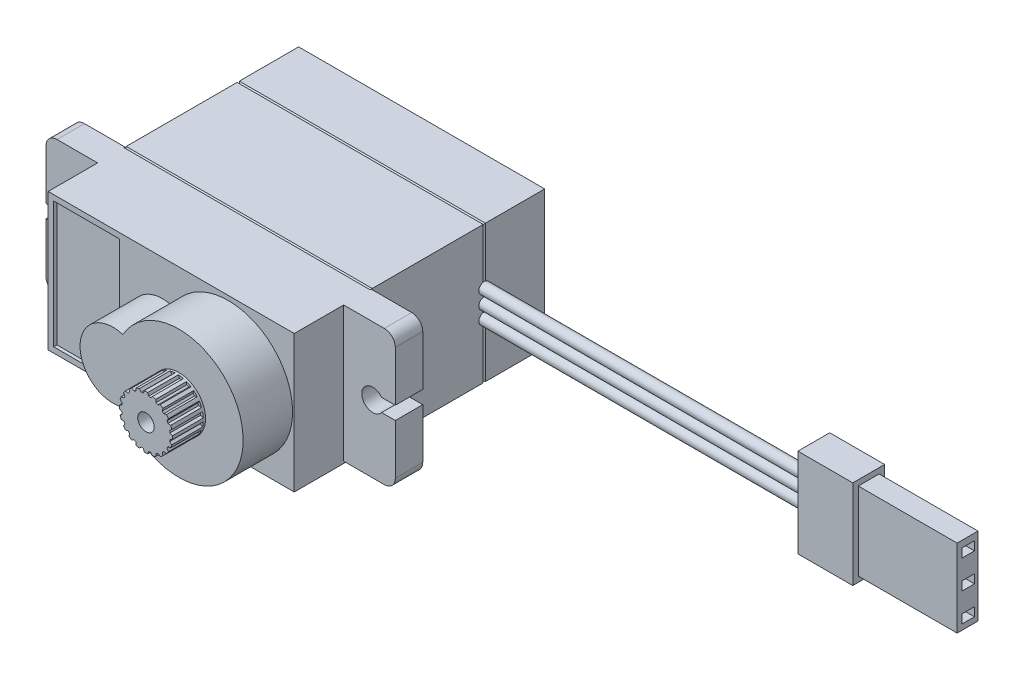
from build123d import *

# Parameters (mm, degrees)
SKETCH_1_W          = 22.4
SKETCH_1_H          = 12.5
EXTRUDE_1_DEPTH     = 5.5
CHAMFER_1_SIZE      = 0.1
SKETCH_2_W          = 22.4
SKETCH_2_H          = 12.5
EXTRUDE_2_DEPTH     = 10.3
CHAMFER_2_SIZE      = 0.1
CHAMFER_3_SIZE      = 0.1
SKETCH_3_W          = 22.4
SKETCH_3_H          = 12.5
EXTRUDE_3_DEPTH     = 7
CHAMFER_4_SIZE      = 0.1
EXTRUDE_4_DEPTH     = 2.5
EXTRUDE_5_DEPTH     = 4.5
SKETCH_6_R          = 2.425
EXTRUDE_6_DEPTH     = 3
SKETCH_7_R          = 0.75
CUT_EXTRUDE_1_DEPTH = 6
CUT_EXTRUDE_START   = -2.8
CUT_EXTRUDE_2_DEPTH = 2.8
SKETCH_9_R          = 0.5
EXTRUDE_7_DEPTH     = 30
SKETCH_10_W         = 2.9
SKETCH_10_H         = 8.1
EXTRUDE_8_DEPTH     = 5
SKETCH_11_W         = 1.9
SKETCH_11_H         = 7.1
SKETCH_11_W_2       = 1.155481654
SKETCH_11_H_2       = 0.8
EXTRUDE_9_DEPTH     = 9
FILLET_2_R          = 1
SKETCH_12_W         = 6
SKETCH_12_H         = 11.5
CUT_EXTRUDE_3_DEPTH = 0.3
SKETCH_13_R         = 1
EXTRUDE_10_DEPTH    = 0.1


with BuildPart() as part:
    # 草图1 → 凸台-拉伸1 (new body)
    with BuildSketch(Plane.XY):
        Rectangle(SKETCH_1_W, SKETCH_1_H)
    extrude(amount=EXTRUDE_1_DEPTH)

    # 倒角1
    chamfer_1_edges = [part.edges().sort_by_distance(p)[0] for p in [
        (11.2, 0, 5.5),
        (0, 6.25, 5.5),
        (-11.2, 0, 5.5),
        (0, -6.25, 5.5),
    ]]
    chamfer(chamfer_1_edges, length=CHAMFER_1_SIZE)

    # 草图2 → 凸台-拉伸2 (add)
    with BuildSketch(Plane.XY.offset(5.5)):
        Rectangle(SKETCH_2_W, SKETCH_2_H)
    extrude(amount=EXTRUDE_2_DEPTH)

    # 倒角2
    chamfer_2_edges = [part.edges().sort_by_distance(p)[0] for p in [
        (0, 6.25, 5.5),
        (-11.2, 0, 5.5),
        (0, -6.25, 5.5),
        (11.2, 0, 5.5),
    ]]
    chamfer(chamfer_2_edges, length=CHAMFER_2_SIZE - 0.0001)  # a hair under: the kernel refuses the full size

    # 倒角3
    chamfer_3_edges = [part.edges().sort_by_distance(p)[0] for p in [
        (0, 6.25, 15.8),
        (-11.2, 0, 15.8),
        (0, -6.25, 15.8),
        (11.2, 0, 15.8),
    ]]
    chamfer(chamfer_3_edges, length=CHAMFER_3_SIZE)

    # 草图3 → 凸台-拉伸3 (add)
    with BuildSketch(Plane.XY.offset(15.8)):
        Rectangle(SKETCH_3_W, SKETCH_3_H)
    extrude(amount=EXTRUDE_3_DEPTH)

    # 倒角4
    chamfer_4_edges = [part.edges().sort_by_distance(p)[0] for p in [
        (0, 6.25, 15.8),
        (-11.2, 0, 15.8),
        (0, -6.25, 15.8),
        (11.2, 0, 15.8),
    ]]
    chamfer(chamfer_4_edges, length=CHAMFER_4_SIZE - 0.0001)  # a hair under: the kernel refuses the full size

    # 草图4 → 凸台-拉伸4 (add)
    with BuildSketch(Plane.XY.offset(15.8)):
        with BuildLine():
            Line((-15.9, -0.508346778), (-15.9, -6.066693556))
            Line((-15.9, -6.066693556), (-11.2, -6.066693556))
            Line((-11.2, -6.066693556), (-11.2, 6.25))
            Line((-11.2, 6.25), (-15.9, 6.25))
            Line((-15.9, 6.25), (-15.9, 0.691653222))
            Line((-15.9, 0.691653222), (-14.65, 0.691653222))
            ThreePointArc((-14.65, 0.691653222), (-12.85, 0.091653222), (-14.65, -0.508346778))
            Line((-14.65, -0.508346778), (-15.9, -0.508346778))
        make_face()
        with BuildLine():
            Line((11.2, -6.066693556), (15.9, -6.066693556))
            Line((15.9, -6.066693556), (15.9, -0.508346778))
            Line((15.9, -0.508346778), (14.65, -0.508346778))
            ThreePointArc((14.65, -0.508346778), (12.85, 0.091653222), (14.65, 0.691653222))
            Line((14.65, 0.691653222), (15.9, 0.691653222))
            Line((15.9, 0.691653222), (15.9, 6.25))
            Line((15.9, 6.25), (11.2, 6.25))
            Line((11.2, 6.25), (11.2, -6.066693556))
        make_face()
    extrude(amount=EXTRUDE_4_DEPTH)

    # 草图5 → 凸台-拉伸5 (add)
    with BuildSketch(Plane.XY.offset(22.8)):
        with BuildLine():
            ThreePointArc((0.098125, -2.86240659), (11.05, 0), (0.098125, 2.86240659))
            ThreePointArc((0.098125, 2.86240659), (-3.8, 0), (0.098125, -2.86240659))
        make_face()
    extrude(amount=EXTRUDE_5_DEPTH)

    # 草图6 → 凸台-拉伸6 (add)
    with BuildSketch(Plane.XY.offset(27.3)):
        with Locations((5.2, 0)):
            Circle(SKETCH_6_R)
    extrude(amount=EXTRUDE_6_DEPTH)

    # 草图7 → 切除-拉伸1 (cut)
    with BuildSketch(Plane.XY.offset(30.3)):
        with Locations((5.2, 0)):
            Circle(SKETCH_7_R)
    extrude(amount=-CUT_EXTRUDE_1_DEPTH, mode=Mode.SUBTRACT)

    # 草图8 → 切除-拉伸2 (cut)
    with BuildSketch(Plane.XY.offset(30.3).offset(CUT_EXTRUDE_START)):
        with BuildLine():
            Line((4.95, 2.185749299), (5.05, 2.420356379))
            ThreePointArc((5.05, 2.420356379), (4.820646422, 2.395144226), (4.594727224, 2.348248255))
            Line((4.594727224, 2.348248255), (4.76233045, 2.156025363))
            ThreePointArc((4.76233045, 2.156025363), (4.855844177, 2.172914349), (4.95, 2.185749299))
        make_face()
        with BuildLine():
            Line((5.45, 2.185749299), (5.35, 2.420356379))
            ThreePointArc((5.35, 2.420356379), (5.579353578, 2.395144226), (5.805272776, 2.348248255))
            Line((5.805272776, 2.348248255), (5.63766955, 2.156025363))
            ThreePointArc((5.63766955, 2.156025363), (5.544155823, 2.172914349), (5.45, 2.185749299))
        make_face()
        with BuildLine():
            Line((6.113197808, 2.001516866), (6.090589731, 2.255543157))
            ThreePointArc((6.090589731, 2.255543157), (6.300926962, 2.160690821), (6.501297236, 2.046277231))
            Line((6.501297236, 2.046277231), (6.282496955, 1.915254642))
            ThreePointArc((6.282496955, 1.915254642), (6.198779099, 1.960214353), (6.113197808, 2.001516866))
        make_face()
        with BuildLine():
            Line((6.687005452, 1.621362016), (6.744002334, 1.869941655))
            ThreePointArc((6.744002334, 1.869941655), (6.914733944, 1.714733944), (7.069941655, 1.544002334))
            Line((7.069941655, 1.544002334), (6.821362016, 1.487005452))
            ThreePointArc((6.821362016, 1.487005452), (6.755634919, 1.555634919), (6.687005452, 1.621362016))
        make_face()
        with BuildLine():
            Line((7.115254642, 1.082496955), (7.246277231, 1.301297236))
            ThreePointArc((7.246277231, 1.301297236), (7.360690821, 1.100926962), (7.455543157, 0.890589731))
            Line((7.455543157, 0.890589731), (7.201516866, 0.913197808))
            ThreePointArc((7.201516866, 0.913197808), (7.160214353, 0.998779099), (7.115254642, 1.082496955))
        make_face()
        with BuildLine():
            Line((7.356025363, 0.43766955), (7.548248255, 0.605272776))
            ThreePointArc((7.548248255, 0.605272776), (7.595144226, 0.379353578), (7.620356379, 0.15))
            Line((7.620356379, 0.15), (7.385749299, 0.25))
            ThreePointArc((7.385749299, 0.25), (7.372914349, 0.344155823), (7.356025363, 0.43766955))
        make_face()
        with BuildLine():
            Line((7.385749299, -0.25), (7.620356379, -0.15))
            ThreePointArc((7.620356379, -0.15), (7.595144226, -0.379353578), (7.548248255, -0.605272776))
            Line((7.548248255, -0.605272776), (7.356025363, -0.43766955))
            ThreePointArc((7.356025363, -0.43766955), (7.372914349, -0.344155823), (7.385749299, -0.25))
        make_face()
        with BuildLine():
            Line((7.201516866, -0.913197808), (7.455543157, -0.890589731))
            ThreePointArc((7.455543157, -0.890589731), (7.360690821, -1.100926962), (7.246277231, -1.301297236))
            Line((7.246277231, -1.301297236), (7.115254642, -1.082496955))
            ThreePointArc((7.115254642, -1.082496955), (7.160214353, -0.998779099), (7.201516866, -0.913197808))
        make_face()
        with BuildLine():
            Line((6.821362016, -1.487005452), (7.069941655, -1.544002334))
            ThreePointArc((7.069941655, -1.544002334), (6.914733944, -1.714733944), (6.744002334, -1.869941655))
            Line((6.744002334, -1.869941655), (6.687005452, -1.621362016))
            ThreePointArc((6.687005452, -1.621362016), (6.755634919, -1.555634919), (6.821362016, -1.487005452))
        make_face()
        with BuildLine():
            Line((6.282496955, -1.915254642), (6.501297236, -2.046277231))
            ThreePointArc((6.501297236, -2.046277231), (6.300926962, -2.160690821), (6.090589731, -2.255543157))
            Line((6.090589731, -2.255543157), (6.113197808, -2.001516866))
            ThreePointArc((6.113197808, -2.001516866), (6.198779099, -1.960214353), (6.282496955, -1.915254642))
        make_face()
        with BuildLine():
            Line((5.63766955, -2.156025363), (5.805272776, -2.348248255))
            ThreePointArc((5.805272776, -2.348248255), (5.579353578, -2.395144226), (5.35, -2.420356379))
            Line((5.35, -2.420356379), (5.45, -2.185749299))
            ThreePointArc((5.45, -2.185749299), (5.544155823, -2.172914349), (5.63766955, -2.156025363))
        make_face()
        with BuildLine():
            Line((4.95, -2.185749299), (5.05, -2.420356379))
            ThreePointArc((5.05, -2.420356379), (4.820646422, -2.395144226), (4.594727224, -2.348248255))
            Line((4.594727224, -2.348248255), (4.76233045, -2.156025363))
            ThreePointArc((4.76233045, -2.156025363), (4.855844177, -2.172914349), (4.95, -2.185749299))
        make_face()
        with BuildLine():
            Line((4.286802192, -2.001516866), (4.309410269, -2.255543157))
            ThreePointArc((4.309410269, -2.255543157), (4.099073038, -2.160690821), (3.898702764, -2.046277231))
            Line((3.898702764, -2.046277231), (4.117503045, -1.915254642))
            ThreePointArc((4.117503045, -1.915254642), (4.201220901, -1.960214353), (4.286802192, -2.001516866))
        make_face()
        with BuildLine():
            Line((3.712994548, -1.621362016), (3.655997666, -1.869941655))
            ThreePointArc((3.655997666, -1.869941655), (3.485266056, -1.714733944), (3.330058345, -1.544002334))
            Line((3.330058345, -1.544002334), (3.578637984, -1.487005452))
            ThreePointArc((3.578637984, -1.487005452), (3.644365081, -1.555634919), (3.712994548, -1.621362016))
        make_face()
        with BuildLine():
            Line((3.284745358, -1.082496955), (3.153722769, -1.301297236))
            ThreePointArc((3.153722769, -1.301297236), (3.039309179, -1.100926962), (2.944456843, -0.890589731))
            Line((2.944456843, -0.890589731), (3.198483134, -0.913197808))
            ThreePointArc((3.198483134, -0.913197808), (3.239785647, -0.998779099), (3.284745358, -1.082496955))
        make_face()
        with BuildLine():
            Line((3.043974637, -0.43766955), (2.851751745, -0.605272776))
            ThreePointArc((2.851751745, -0.605272776), (2.804855774, -0.379353578), (2.779643621, -0.15))
            Line((2.779643621, -0.15), (3.014250701, -0.25))
            ThreePointArc((3.014250701, -0.25), (3.027085651, -0.344155823), (3.043974637, -0.43766955))
        make_face()
        with BuildLine():
            Line((3.014250701, 0.25), (2.779643621, 0.15))
            ThreePointArc((2.779643621, 0.15), (2.804855774, 0.379353578), (2.851751745, 0.605272776))
            Line((2.851751745, 0.605272776), (3.043974637, 0.43766955))
            ThreePointArc((3.043974637, 0.43766955), (3.027085651, 0.344155823), (3.014250701, 0.25))
        make_face()
        with BuildLine():
            Line((3.198483134, 0.913197808), (2.944456843, 0.890589731))
            ThreePointArc((2.944456843, 0.890589731), (3.039309179, 1.100926962), (3.153722769, 1.301297236))
            Line((3.153722769, 1.301297236), (3.284745358, 1.082496955))
            ThreePointArc((3.284745358, 1.082496955), (3.239785647, 0.998779099), (3.198483134, 0.913197808))
        make_face()
        with BuildLine():
            Line((3.578637984, 1.487005452), (3.330058345, 1.544002334))
            ThreePointArc((3.330058345, 1.544002334), (3.485266056, 1.714733944), (3.655997666, 1.869941655))
            Line((3.655997666, 1.869941655), (3.712994548, 1.621362016))
            ThreePointArc((3.712994548, 1.621362016), (3.644365081, 1.555634919), (3.578637984, 1.487005452))
        make_face()
        with BuildLine():
            Line((4.117503045, 1.915254642), (3.898702764, 2.046277231))
            ThreePointArc((3.898702764, 2.046277231), (4.099073038, 2.160690821), (4.309410269, 2.255543157))
            Line((4.309410269, 2.255543157), (4.286802192, 2.001516866))
            ThreePointArc((4.286802192, 2.001516866), (4.201220901, 1.960214353), (4.117503045, 1.915254642))
        make_face()
    extrude(amount=CUT_EXTRUDE_2_DEPTH, mode=Mode.SUBTRACT)

    # 草图9 → 凸台-拉伸7 (add)
    with BuildSketch(Plane(origin=(11.2, 0, 0), x_dir=(0, 0, -1), z_dir=(1, 0, 0))):
        with Locations(Location((-5.5, 0, 0), (0, 0, 101.536959033))):
            Circle(SKETCH_9_R)
        with Locations(Location((-5.5, 1.2, 0), (0, 0, 258.463040967))):
            Circle(SKETCH_9_R)
        with Locations(Location((-5.5, -1.2, 0), (0, 0, 101.536959033))):
            Circle(SKETCH_9_R)
    extrude(amount=EXTRUDE_7_DEPTH)

    # 草图10 → 凸台-拉伸8 (add)
    with BuildSketch(Plane(origin=(41.2, 0, 0), x_dir=(0, 0, -1), z_dir=(1, 0, 0))):
        with Locations((-5.5, 0)):
            Rectangle(SKETCH_10_W, SKETCH_10_H)
    extrude(amount=EXTRUDE_8_DEPTH)

    # 草图11 → 凸台-拉伸9 (add)
    with BuildSketch(Plane(origin=(46.2, 0, 0), x_dir=(0, 0, -1), z_dir=(1, 0, 0))):
        with Locations((-5.5, 0)):
            Rectangle(SKETCH_11_W, SKETCH_11_H)
        with Locations((-5.451131572, 2.55)):
            Rectangle(SKETCH_11_W_2, SKETCH_11_H_2, mode=Mode.SUBTRACT)
        with Locations((-5.451131572, -0.05)):
            Rectangle(SKETCH_11_W_2, SKETCH_11_H_2, mode=Mode.SUBTRACT)
        with Locations((-5.451131572, -2.65)):
            Rectangle(SKETCH_11_W_2, SKETCH_11_H_2, mode=Mode.SUBTRACT)
    extrude(amount=EXTRUDE_9_DEPTH)

    # 圆角2
    fillet_2_edges = [part.edges().sort_by_distance(p)[0] for p in [
        (15.9, -6.066693556, 17.05),
        (15.9, 6.25, 17.05),
        (-15.9, 6.25, 17.05),
        (-15.9, -6.066693556, 17.05),
    ]]
    fillet(fillet_2_edges, radius=FILLET_2_R)

    # 草图12 → 切除-拉伸3 (cut)
    with BuildSketch(Plane.XY.offset(22.8)):
        with Locations((-7.7, 0)):
            Rectangle(SKETCH_12_W, SKETCH_12_H)
    extrude(amount=-CUT_EXTRUDE_3_DEPTH, mode=Mode.SUBTRACT)

    # 草图13 → 凸台-拉伸10 (add)
    # profile 1 of 4: a face of its own
    with BuildSketch(Plane(origin=(0, 0, 0), x_dir=(-1, 0, 0), z_dir=(0, 0, -1))):
        with Locations(Location((-10, 5, 0), (0, 0, 180))):
            Circle(SKETCH_13_R)
        with BuildLine():
            Line((-10.15, 5.785811682), (-10.15, 5.15))
            Line((-10.15, 5.15), (-10.785811682, 5.15))
            ThreePointArc((-10.785811682, 5.15), (-10.8, 5), (-10.785811682, 4.85))
            Line((-10.785811682, 4.85), (-10.15, 4.85))
            Line((-10.15, 4.85), (-10.15, 4.214188318))
            ThreePointArc((-10.15, 4.214188318), (-10, 4.2), (-9.85, 4.214188318))
            Line((-9.85, 4.214188318), (-9.85, 4.85))
            Line((-9.85, 4.85), (-9.214188318, 4.85))
            ThreePointArc((-9.214188318, 4.85), (-9.2, 5), (-9.214188318, 5.15))
            Line((-9.214188318, 5.15), (-9.85, 5.15))
            Line((-9.85, 5.15), (-9.85, 5.785811682))
            ThreePointArc((-9.85, 5.785811682), (-10, 5.8), (-10.15, 5.785811682))
        make_face(mode=Mode.SUBTRACT)
    # profile 2 of 4: a face of its own
    with BuildSketch(Plane(origin=(0, 0, 0), x_dir=(-1, 0, 0), z_dir=(0, 0, -1))):
        with Locations(Location((-10, -5, 0), (0, 0, 180))):
            Circle(SKETCH_13_R)
        with BuildLine():
            Line((-9.85, -5.15), (-9.214188318, -5.15))
            ThreePointArc((-9.214188318, -5.15), (-9.2, -5), (-9.214188318, -4.85))
            Line((-9.214188318, -4.85), (-9.85, -4.85))
            Line((-9.85, -4.85), (-9.85, -4.214188318))
            ThreePointArc((-9.85, -4.214188318), (-10, -4.2), (-10.15, -4.214188318))
            Line((-10.15, -4.214188318), (-10.15, -4.85))
            Line((-10.15, -4.85), (-10.785811682, -4.85))
            ThreePointArc((-10.785811682, -4.85), (-10.8, -5), (-10.785811682, -5.15))
            Line((-10.785811682, -5.15), (-10.15, -5.15))
            Line((-10.15, -5.15), (-10.15, -5.785811682))
            ThreePointArc((-10.15, -5.785811682), (-10, -5.8), (-9.85, -5.785811682))
            Line((-9.85, -5.785811682), (-9.85, -5.15))
        make_face(mode=Mode.SUBTRACT)
    # profile 3 of 4: a face of its own
    with BuildSketch(Plane(origin=(0, 0, 0), x_dir=(-1, 0, 0), z_dir=(0, 0, -1))):
        with Locations(Location((10, -5, 0), (0, 0, 180))):
            Circle(SKETCH_13_R)
        with BuildLine():
            Line((9.85, -4.85), (9.214188318, -4.85))
            ThreePointArc((9.214188318, -4.85), (9.2, -5), (9.214188318, -5.15))
            Line((9.214188318, -5.15), (9.85, -5.15))
            Line((9.85, -5.15), (9.85, -5.785811682))
            ThreePointArc((9.85, -5.785811682), (10, -5.8), (10.15, -5.785811682))
            Line((10.15, -5.785811682), (10.15, -5.15))
            Line((10.15, -5.15), (10.785811682, -5.15))
            ThreePointArc((10.785811682, -5.15), (10.8, -5), (10.785811682, -4.85))
            Line((10.785811682, -4.85), (10.15, -4.85))
            Line((10.15, -4.85), (10.15, -4.214188318))
            ThreePointArc((10.15, -4.214188318), (10, -4.2), (9.85, -4.214188318))
            Line((9.85, -4.214188318), (9.85, -4.85))
        make_face(mode=Mode.SUBTRACT)
    # profile 4 of 4: a face of its own
    with BuildSketch(Plane(origin=(0, 0, 0), x_dir=(-1, 0, 0), z_dir=(0, 0, -1))):
        with Locations(Location((10, 5, 0), (0, 0, 180))):
            Circle(SKETCH_13_R)
        with BuildLine():
            Line((10.15, 5.785811682), (10.15, 5.15))
            Line((10.15, 5.15), (10.785811682, 5.15))
            ThreePointArc((10.785811682, 5.15), (10.8, 5), (10.785811682, 4.85))
            Line((10.785811682, 4.85), (10.15, 4.85))
            Line((10.15, 4.85), (10.15, 4.214188318))
            ThreePointArc((10.15, 4.214188318), (10, 4.2), (9.85, 4.214188318))
            Line((9.85, 4.214188318), (9.85, 4.85))
            Line((9.85, 4.85), (9.214188318, 4.85))
            ThreePointArc((9.214188318, 4.85), (9.2, 5), (9.214188318, 5.15))
            Line((9.214188318, 5.15), (9.85, 5.15))
            Line((9.85, 5.15), (9.85, 5.785811682))
            ThreePointArc((9.85, 5.785811682), (10, 5.8), (10.15, 5.785811682))
        make_face(mode=Mode.SUBTRACT)
    extrude(amount=EXTRUDE_10_DEPTH)


solid = part.part
